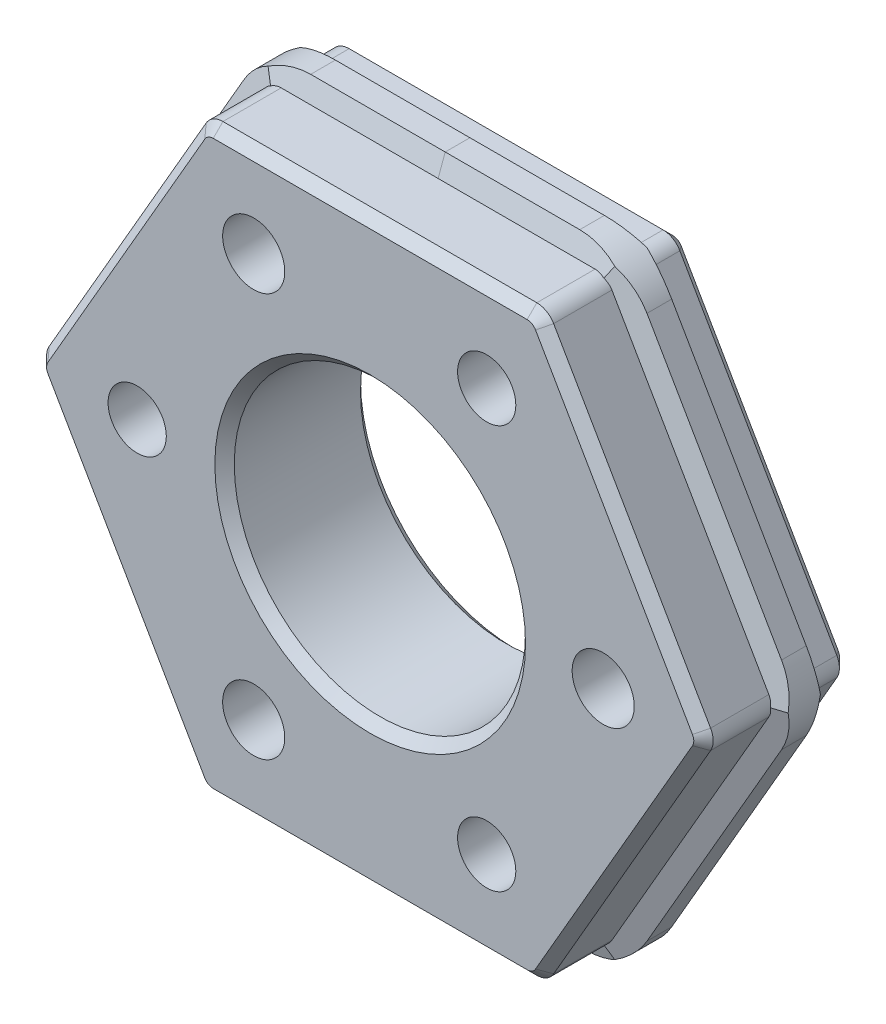
from build123d import *

# Parameters (mm, degrees)
SKETCH_1_W                   = 40
SKETCH_1_H                   = 40
SKETCH_1_R                   = 7.5
EXTRUDE_1_DEPTH              = 3
SKETCH_23_W                  = 40
SKETCH_23_H                  = 40
SKETCH_23_R                  = 7.5
EXTRUDE_4_DEPTH              = 1.5
HOLE_WIZARD_M3_1_D           = 3.2
HOLE_WIZARD_M3_1_CBORE_D     = 6
HOLE_WIZARD_M3_1_CBORE_DEPTH = 4
F_3_0MM_1_D                  = 3
F_3_0MM_1_DEPTH              = 4
F_3_0MM_1_TIP                = 0.901290929
SKETCH_26_OUTSIDE_W          = 53.412
SKETCH_26_OUTSIDE_H          = 53.412
CUT_EXTRUDE_1_DEPTH          = 30.261749777
FILLET_2_R                   = 4
FILLET_3_R                   = 1
CHAMFER_1_SIZE               = 0.5


with BuildPart() as part:
    # 草图1 → 凸台-拉伸1 (new, symmetric)
    with BuildSketch(Plane.XY):
        Rectangle(SKETCH_1_W, SKETCH_1_H)
        Circle(SKETCH_1_R, mode=Mode.SUBTRACT)
    extrude(amount=EXTRUDE_1_DEPTH, both=True)

    # 草图23 → 凸台-拉伸4 (add)
    with BuildSketch(Plane.XY.offset(3)):
        Rectangle(SKETCH_23_W, SKETCH_23_H)
        Circle(SKETCH_23_R, mode=Mode.SUBTRACT)
    extrude(amount=EXTRUDE_4_DEPTH)

    # M3 六角圆柱头螺钉的柱形沉头孔1 (through all)
    with Locations(Plane(origin=(0, 0, -3), x_dir=(-1, 0, 0), z_dir=(0, 0, -1))):
        with Locations((-12, 0), (6, 10.392304845), (6, -10.392304845)):
            CounterBoreHole(HOLE_WIZARD_M3_1_D / 2, HOLE_WIZARD_M3_1_CBORE_D / 2, HOLE_WIZARD_M3_1_CBORE_DEPTH)

    # Ø3.0mm 暗销孔1
    with Locations(Plane.XY.offset(4.5)):
        with Locations((-12, 0), (6, 10.392304845), (6, -10.392304845)):
            Hole(F_3_0MM_1_D / 2, depth=F_3_0MM_1_DEPTH)
            with Locations((0, 0, -(F_3_0MM_1_DEPTH + F_3_0MM_1_TIP / 2))):  # 118° drill point
                Cone(0, F_3_0MM_1_D / 2, F_3_0MM_1_TIP, mode=Mode.SUBTRACT)

    # 草图26 outside → 切除-拉伸1 (cut, through all)
    with BuildSketch(Plane(origin=(0, 0, -3), x_dir=(-1, 0, 0), z_dir=(0, 0, -1))):
        Rectangle(SKETCH_26_OUTSIDE_W, SKETCH_26_OUTSIDE_H)
        Polygon((-17.320508076, 0), (-8.660254038, -15), (8.660254038, -15), (17.320508076, 0), (8.660254038, 15), (-8.660254038, 15), align=None, mode=Mode.SUBTRACT)
    extrude(amount=-CUT_EXTRUDE_1_DEPTH, mode=Mode.SUBTRACT)

    # 扫描1: sweep along a path in 草图44
    with BuildLine(Plane(origin=(0, 0, -1), x_dir=(-1, 0, 0), z_dir=(0, 0, -1))) as sweep_1_path:
        Line((-17.320508076, 0), (-8.660254038, -15))
        Line((-8.660254038, -15), (8.660254038, -15))
        Line((8.660254038, -15), (17.320508076, 0))
        Line((17.320508076, 0), (8.660254038, 15))
        Line((8.660254038, 15), (-8.660254038, 15))
        Line((-8.660254038, 15), (-17.320508076, 0))
    # 草图43 → 扫描1 (sweep)
    with BuildSketch(Plane(origin=(0, 0, 0), x_dir=(0, 0, -1), z_dir=(1, 0, 0))):
        Polygon((-1, 15), (1, 15), (0.636029766, 16), (-0.636029766, 16), align=None)
    sweep(path=sweep_1_path.line, transition=Transition.RIGHT)

    # 圆角2
    fillet_2_edges = [part.edges().sort_by_distance(p)[0] for p in [
        (9.237604307, 16, 0),
        (-9.237604307, 16, 0),
        (-18.475208614, 0, 0),
        (-9.237604307, -16, 0),
        (9.237604307, -16, 0),
        (18.475208614, 0, 0),
    ]]
    fillet(fillet_2_edges, radius=FILLET_2_R)

    # 圆角3
    fillet_3_edges = [part.edges().sort_by_distance(p)[0] for p in [
        (-8.660254038, 15, -2),
        (-8.660254038, 15, 2.75),
        (-17.320508076, 0, -2),
        (-17.320508076, 0, 2.75),
        (-8.660254038, -15, 2.75),
        (-8.660254038, -15, -2),
        (8.660254038, -15, 2.75),
        (8.660254038, -15, -2),
        (17.320508076, 0, -2),
        (17.320508076, 0, 2.75),
        (8.660254038, 15, 2.75),
        (8.660254038, 15, -2),
    ]]
    fillet(fillet_3_edges, radius=FILLET_3_R)

    # 倒角1
    chamfer_1_edges = [part.edges().sort_by_distance(p)[0] for p in [
        (-7.5, 0, 4.5),
        (-7.5, 0, -3),
        (0, -15, -3),
        (-8.582903769, -14.866025404, -3),
        (8.582903769, -14.866025404, -3),
        (-12.990381057, -7.5, -3),
        (12.990381057, -7.5, -3),
        (-17.165807537, 0, -3),
        (17.165807537, 0, -3),
        (-12.990381057, 7.5, -3),
        (12.990381057, 7.5, -3),
        (-8.582903769, 14.866025404, -3),
        (8.582903769, 14.866025404, -3),
        (0, 15, -3),
        (0, -15, 4.5),
        (-8.582903769, -14.866025404, 4.5),
        (8.582903769, -14.866025404, 4.5),
        (-12.990381057, -7.5, 4.5),
        (12.990381057, -7.5, 4.5),
        (-17.165807537, 0, 4.5),
        (17.165807537, 0, 4.5),
        (-12.990381057, 7.5, 4.5),
        (12.990381057, 7.5, 4.5),
        (-8.582903769, 14.866025404, 4.5),
        (8.582903769, 14.866025404, 4.5),
        (0, 15, 4.5),
    ]]
    chamfer(chamfer_1_edges, length=CHAMFER_1_SIZE)


solid = part.part
